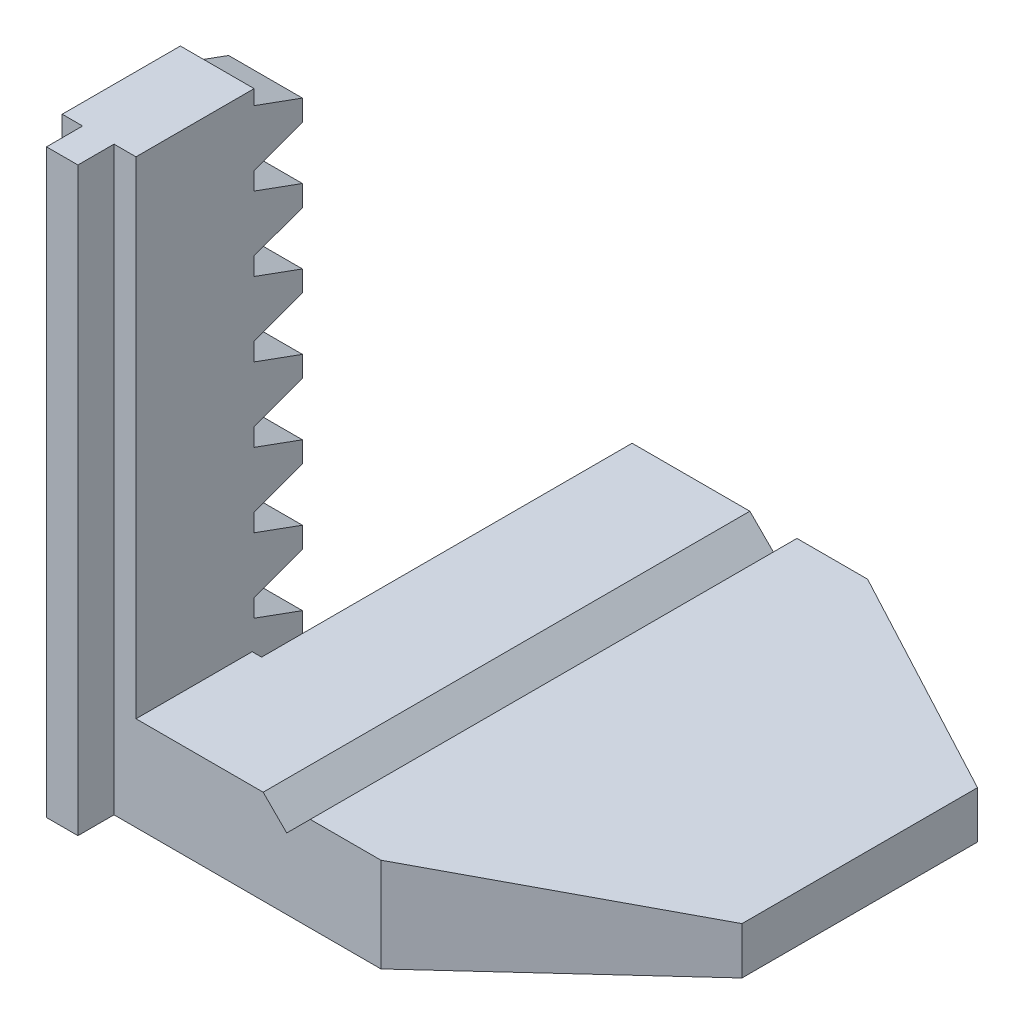
from build123d import *

# Parameters (mm, degrees)
BOSS_EXTRUDE1_DEPTH = 4.7
SKETCH2_W           = 2.4
SKETCH2_H           = 37
BOSS_EXTRUDE2_DEPTH = 2
SKETCH3_W           = 7.4
SKETCH3_H           = 6
BOSS_EXTRUDE3_DEPTH = 0.8
SKETCH4_W           = 31
SKETCH4_H           = 6
BOSS_EXTRUDE4_DEPTH = 30
CUT_EXTRUDE1_DEPTH  = 6.5
CUT_EXTRUDE2_DEPTH  = 405.447882922
CUT_EXTRUDE3_DEPTH  = 405.447882922


with BuildPart() as part:
    # Sketch1 → Boss-Extrude1 (new body)
    with BuildSketch(Plane(origin=(209.7, 0, 0), x_dir=(0, 0, -1), z_dir=(1, 0, 0))):
        Polygon((-318, -6), (-318, 31), (-310.475, 31), (-310.475, 30.0599), (-307.4, 28.9407), (-307.4, 27.608), (-310.475, 26.4888), (-310.475, 25.3475), (-307.4, 24.2283), (-307.4, 22.8956), (-310.475, 21.7764), (-310.475, 20.6351), (-307.4, 19.5159), (-307.4, 18.1832), (-310.475, 17.064), (-310.475, 15.9227), (-307.4, 14.8035), (-307.4, 13.4708), (-310.475, 12.3516), (-310.475, 11.2103), (-307.4, 10.0911), (-307.4, 8.7584), (-310.475, 7.6392), (-310.475, 6.4979), (-307.4, 5.3787), (-307.4, 4.0461), (-310.475, 2.9268), (-310.475, 1.7855), (-307.4, 0.6663), (-307.4, -0.6663), (-310.475, -1.7855), (-310.475, -2.9268), (-307.4, -4.0461), (-307.4, -5.3787), (-309.1069, -6), align=None)
    extrude(amount=BOSS_EXTRUDE1_DEPTH)

    # Sketch2 → Boss-Extrude2 (add)
    with BuildSketch(Plane(origin=(211, 0, 0), x_dir=(0, 0, -1), z_dir=(1, 0, 0))):
        with Locations((-319.1, 12.5)):
            Rectangle(SKETCH2_W, SKETCH2_H)
    extrude(amount=BOSS_EXTRUDE2_DEPTH)

    # Sketch3 → Boss-Extrude3 (add)
    with BuildSketch(Plane(origin=(214.4, 0, 0), x_dir=(0, 0, -1), z_dir=(1, 0, 0))):
        with Locations((-314.3, -3)):
            Rectangle(SKETCH3_W, SKETCH3_H)
    extrude(amount=BOSS_EXTRUDE3_DEPTH)

    # Sketch4 → Boss-Extrude4 (add)
    with BuildSketch(Plane(origin=(215, 0, 0), x_dir=(0, 0, -1), z_dir=(1, 0, 0))):
        with Locations((-302.5, -3)):
            Rectangle(SKETCH4_W, SKETCH4_H)
    extrude(amount=BOSS_EXTRUDE4_DEPTH)

    # Sketch5 → Cut-Extrude1 (cut, symmetric)
    with BuildSketch(Plane(origin=(0, 0, 0), x_dir=(1, 0, 0), z_dir=(0, 1, 0))):
        Polygon((228.125, -319), (246.5, -309.2), (246.5, -319), align=None)
        Polygon((228.125, -286), (246.5, -295.8), (246.5, -286), align=None)
    extrude(amount=CUT_EXTRUDE1_DEPTH, both=True, mode=Mode.SUBTRACT)

    # Sketch6 → Cut-Extrude2 (cut, through all)
    with BuildSketch(Plane.XY):
        Polygon((227.5, -6.5), (246.5, -2.7), (246.5, -6.5), align=None)
    extrude(amount=CUT_EXTRUDE2_DEPTH, mode=Mode.SUBTRACT)

    # Sketch7 → Cut-Extrude3 (cut, through all)
    with BuildSketch(Plane.XY):
        Polygon((222, 0.5), (226, 0.5), (224, -1.5), align=None)
    extrude(amount=CUT_EXTRUDE3_DEPTH, mode=Mode.SUBTRACT)


solid = part.part
